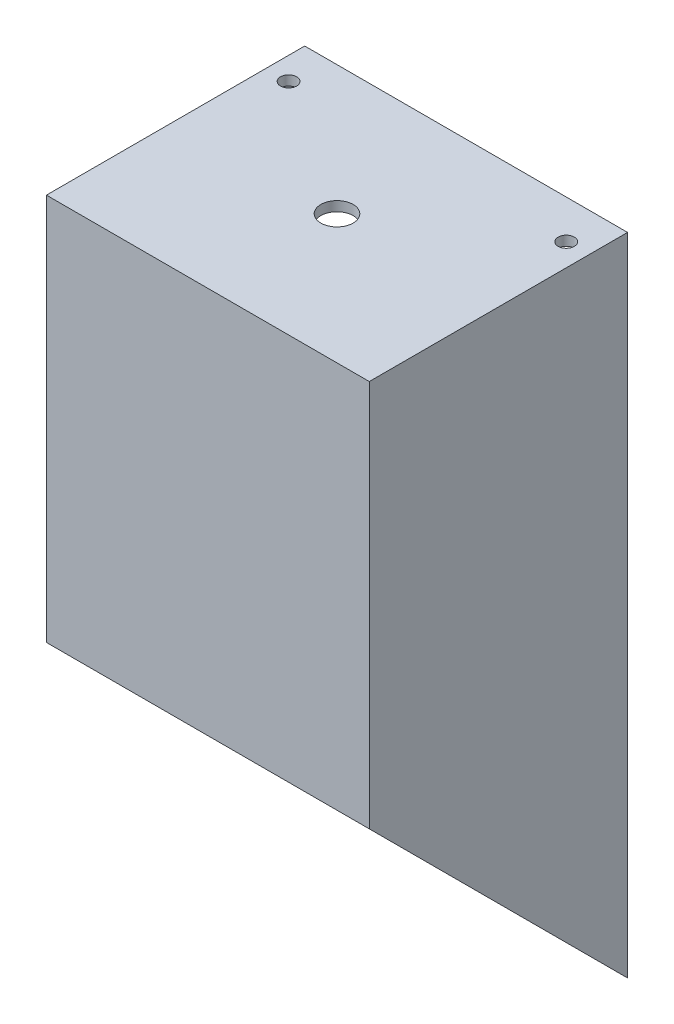
from build123d import *

# Parameters (mm, degrees)
BO_ALTMA1_T           = -1.5
MENFEZ1_START         = -35.355339059
MENFEZ1_DEPTH         = 1.5
IZIM6_R               = 2.5
KES_EKSTR_ZYON2_DEPTH = 111.566722087
KES_EKSTR_ZYON3_DEPTH = 10
IZIM9_R               = 1.5
KES_EKSTR_ZYON4_DEPTH = 0.1
KUBBE2_FACE_RADIUS    = 1.5
KUBBE2_HEIGHT         = 1.3
KES_EKSTR_ZYON5_START = -0.1
IZIM10_R              = 1.5
KES_EKSTR_ZYON5_DEPTH = 0.1
KUBBE3_FACE_RADIUS    = 1.5
KUBBE3_HEIGHT         = 1.3
KES_EKSTR_ZYON6_REACH = 112.567
IZIM11_R              = 1.25


# Read off the part's stored shape, not the designer's step: Menfez1
with BuildPart() as part:
    # Çizim2 → Loft1 section 0
    with BuildSketch(Plane.XY.offset(40)):
        with BuildLine():
            Line((-25, 50), (25, 50))
            Line((25, 50), (25, -10))
            Line((25, -10), (-25, -10))
            Line((-25, -10), (-25, 50))
        make_face()
    # Çizim1 → Loft1 section 1
    with BuildSketch(Plane.XY):
        with BuildLine():
            Line((-25, 50), (25, 50))
            Line((25, 50), (25, -50))
            Line((25, -50), (-25, -50))
            Line((-25, -50), (-25, 50))
        make_face()
    loft()

    # İç Boşaltma1
    bo_altma1_openings = [part.faces().sort_by_distance(p)[0] for p in [
        (0, 0, 0),
    ]]
    offset(amount=BO_ALTMA1_T, openings=bo_altma1_openings, kind=Kind.INTERSECTION)

    # Menfez1 outline → Menfez1 (cut)
    with BuildSketch(Plane(origin=(0, 0, 0), x_dir=(1, 0, 0), z_dir=(0, 0.707106781186547, -0.7071067811865479)).offset(MENFEZ1_START)):
        with BuildLine():
            add(Edge.make_bspline(
                [(22.5, 7.071067812), (22.5, 5.598458472), (22.209921279, 2.653239791), (20.921288378, -1.594813577), (18.828662098, -5.509841982), (16.012460892, -8.94139308), (12.580909794, -11.757594286), (8.665881389, -13.850220566), (4.417828021, -15.138853467), (0, -15.573971549), (-4.417828021, -15.138853467), (-8.665881389, -13.850220566), (-12.580909794, -11.757594286), (-16.012460892, -8.94139308), (-18.828662098, -5.509841982), (-20.921288378, -1.594813577), (-22.209921279, 2.653239791), (-22.645039361, 7.071067812), (-22.209921279, 11.488895833), (-20.921288378, 15.7369492), (-18.828662098, 19.651977606), (-16.012460892, 23.083528704), (-12.580909794, 25.89972991), (-8.665881389, 27.99235619), (-4.417828021, 29.280989091), (0, 29.716107172), (4.417828021, 29.280989091), (8.665881389, 27.99235619), (12.580909794, 25.89972991), (16.012460892, 23.083528704), (18.828662098, 19.651977606), (20.921288378, 15.7369492), (22.209921279, 11.488895833), (22.5, 8.543677152), (22.5, 7.071067812)],
                knots=[0, 0, 0, 0, 0.03125, 0.0625, 0.09375, 0.125, 0.15625, 0.1875, 0.21875, 0.25, 0.28125, 0.3125, 0.34375, 0.375, 0.40625, 0.4375, 0.46875, 0.5, 0.53125, 0.5625, 0.59375, 0.625, 0.65625, 0.6875, 0.71875, 0.75, 0.78125, 0.8125, 0.84375, 0.875, 0.90625, 0.9375, 0.96875, 1, 1, 1, 1], degree=3))
        make_face()
    extrude(amount=MENFEZ1_DEPTH, mode=Mode.SUBTRACT)

    # Çizim6 → Kes-Ekstrüzyon2 (cut, through all)
    with BuildSketch(Plane(origin=(0, 50, 0), x_dir=(1, 0, 0), z_dir=(0, 1, 0))):
        with Locations(Location((0, -20, 0), (0, 0, 270))):
            Circle(IZIM6_R)
    extrude(amount=-KES_EKSTR_ZYON2_DEPTH, mode=Mode.SUBTRACT)

    # Çizim7 → Kes-Ekstrüzyon3 (cut)
    with BuildSketch(Plane(origin=(0, -50, 0), x_dir=(1, 0, 0), z_dir=(0, 1, 0))):
        Polygon((19.573356646, -1), (20.223356646, -2.125833025), (18.923356646, -2.125833025), align=None)
        Polygon((-0.426643354, -1), (0.223356646, -2.125833025), (-1.076643354, -2.125833025), align=None)
        Polygon((-20.426643354, -1), (-19.776643354, -2.125833025), (-21.076643354, -2.125833025), align=None)
    extrude(amount=KES_EKSTR_ZYON3_DEPTH, mode=Mode.SUBTRACT)

    # Çizim9 → Kes-Ekstrüzyon4 (cut)
    with BuildSketch(Plane(origin=(-23.5, 0, 0), x_dir=(0, 0, -1), z_dir=(1, 0, 0))):
        with Locations(Location((-6, -23.5, 0), (0, 0, 90))):
            Circle(IZIM9_R)
    extrude(amount=-KES_EKSTR_ZYON4_DEPTH, mode=Mode.SUBTRACT)

    # Kubbe2: a dome of height H over a round flat face of radius A is a cap of a sphere of radius (A * A + H * H) / (2 * H)
    kubbe2_r = (KUBBE2_FACE_RADIUS * KUBBE2_FACE_RADIUS + KUBBE2_HEIGHT * KUBBE2_HEIGHT) / (2 * KUBBE2_HEIGHT)
    kubbe2_base = Plane((-23.6, -23.5, 6), z_dir=(-1, 0, 0))
    with Locations(kubbe2_base.offset(KUBBE2_HEIGHT - kubbe2_r)):
        kubbe2_ball = Sphere(kubbe2_r, mode=Mode.PRIVATE)
    add(split(kubbe2_ball, bisect_by=kubbe2_base, keep=Keep.TOP, mode=Mode.PRIVATE), mode=Mode.SUBTRACT)

    # Çizim10 → Kes-Ekstrüzyon5 (cut)
    with BuildSketch(Plane.ZY.offset(-23.5).offset(KES_EKSTR_ZYON5_START)):
        with Locations(Location((6, -23.5, 0), (0, 0, 90))):
            Circle(IZIM10_R)
    extrude(amount=KES_EKSTR_ZYON5_DEPTH, mode=Mode.SUBTRACT)

    # Kubbe3: a dome of height H over a round flat face of radius A is a cap of a sphere of radius (A * A + H * H) / (2 * H)
    kubbe3_r = (KUBBE3_FACE_RADIUS * KUBBE3_FACE_RADIUS + KUBBE3_HEIGHT * KUBBE3_HEIGHT) / (2 * KUBBE3_HEIGHT)
    kubbe3_base = Plane((23.6, -23.5, 6), z_dir=(1, 0, 0))
    with Locations(kubbe3_base.offset(KUBBE3_HEIGHT - kubbe3_r)):
        kubbe3_ball = Sphere(kubbe3_r, mode=Mode.PRIVATE)
    add(split(kubbe3_ball, bisect_by=kubbe3_base, keep=Keep.TOP, mode=Mode.PRIVATE), mode=Mode.SUBTRACT)

    # Çizim11 → Kes-Ekstrüzyon6 (cut, up to next)
    with BuildSketch(Plane(origin=(0, 50, 0), x_dir=(1, 0, 0), z_dir=(0, 1, 0)), mode=Mode.PRIVATE) as kes_ekstr_zyon6_sk1:
        with Locations(Location((21.5, -6, 0), (0, 0, 270))):
            Circle(IZIM11_R)
    kes_ekstr_zyon6_tool1 = extrude(kes_ekstr_zyon6_sk1.sketch, amount=-KES_EKSTR_ZYON6_REACH, mode=Mode.PRIVATE) & part.part
    # Çizim11 → Kes-Ekstrüzyon6 (cut, up to next)
    with BuildSketch(Plane(origin=(0, 50, 0), x_dir=(1, 0, 0), z_dir=(0, 1, 0)), mode=Mode.PRIVATE) as kes_ekstr_zyon6_sk2:
        with Locations(Location((-21.5, -6, 0), (0, 0, 270))):
            Circle(IZIM11_R)
    kes_ekstr_zyon6_tool2 = extrude(kes_ekstr_zyon6_sk2.sketch, amount=-KES_EKSTR_ZYON6_REACH, mode=Mode.PRIVATE) & part.part
    add(kes_ekstr_zyon6_tool1.solids().sort_by_distance((21.5, 50, 6))[0], mode=Mode.SUBTRACT)
    add(kes_ekstr_zyon6_tool2.solids().sort_by_distance((-21.5, 50, 6))[0], mode=Mode.SUBTRACT)


solid = part.part
